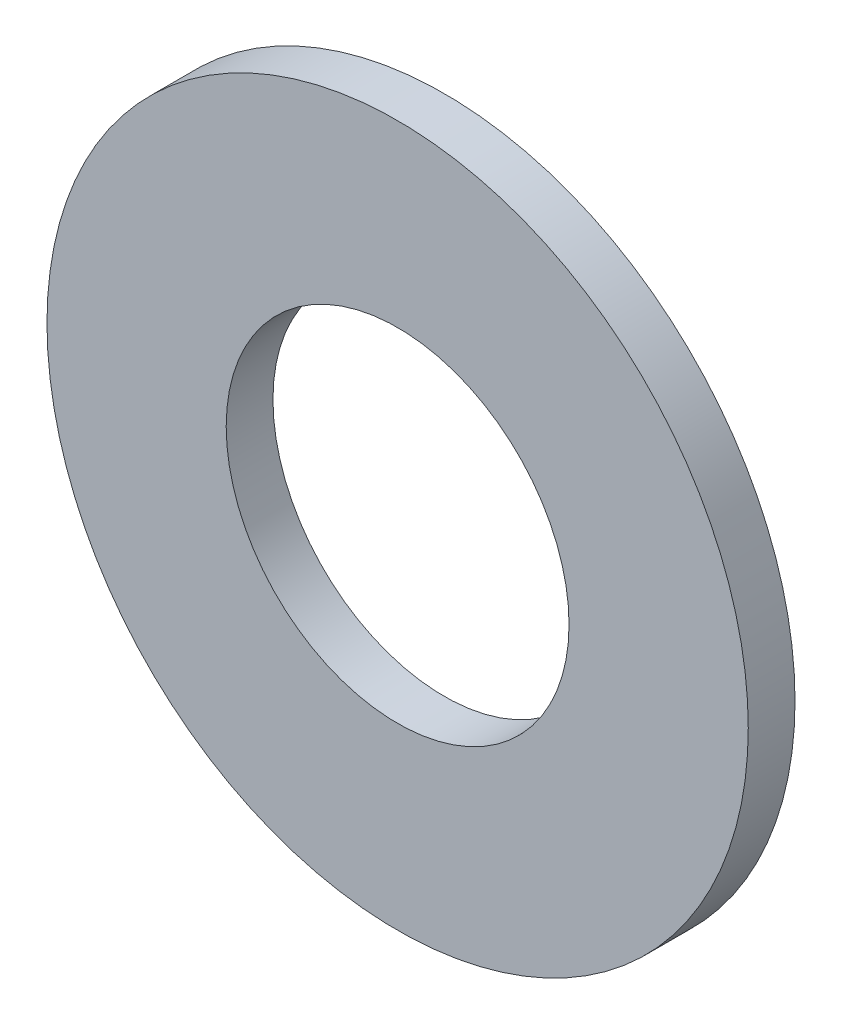
from build123d import *

# Parameters (mm, degrees)
SKETCH_1_R             = 22.5
SKETCH_1_R_2           = 11
SM_BASE_FLANGE_1_DEPTH = 3


# Sheet-metal steps are written as plain solids
with BuildPart() as part:
    # Sketch 1 → 基体-法兰1 (new body)
    with BuildSketch(Plane.XY):
        Circle(SKETCH_1_R)
        Circle(SKETCH_1_R_2, mode=Mode.SUBTRACT)
    extrude(amount=-SM_BASE_FLANGE_1_DEPTH)


solid = part.part
